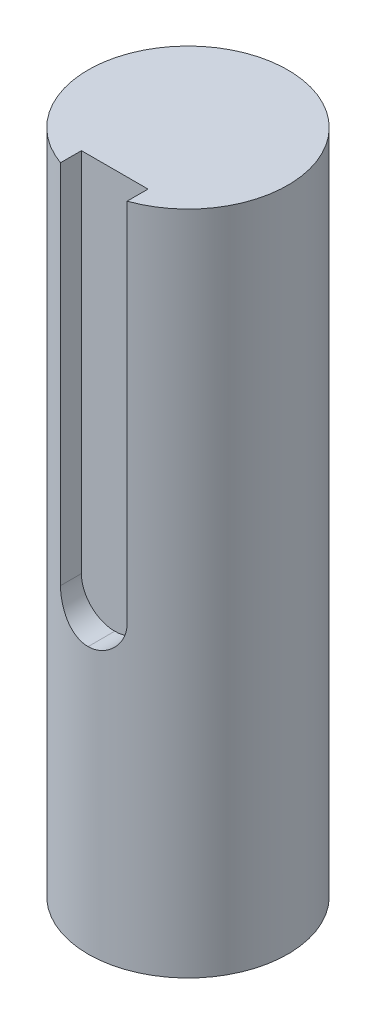
from build123d import *

# Parameters (mm, degrees)
SKETCH2_R           = 15
BOSS_EXTRUDE1_DEPTH = 50
SKETCH3_W           = 10
SKETCH3_H           = 8
CUT_EXTRUDE1_DEPTH  = 60
FILLET1_R           = 5


with BuildPart() as part:
    # Sketch2 → Boss-Extrude1 (new, symmetric)
    with BuildSketch(Plane(origin=(0, 0, 0), x_dir=(-1, 0, 0), z_dir=(0, 1, 0))):
        with Locations(Location((0, 0, 0), (0, 0, 90))):
            Circle(SKETCH2_R)
    extrude(amount=BOSS_EXTRUDE1_DEPTH, both=True)

    # Sketch3 → Cut-Extrude1 (cut)
    with BuildSketch(Plane(origin=(0, 50, 0), x_dir=(-1, 0, 0), z_dir=(0, 1, 0))):
        with Locations((0, 15)):
            Rectangle(SKETCH3_W, SKETCH3_H)
    extrude(amount=-CUT_EXTRUDE1_DEPTH, mode=Mode.SUBTRACT)

    # Fillet1
    fillet1_edges = [part.edges().sort_by_distance(p)[0] for p in [
        (5, -10, 12.571067812),
        (-5, -10, 12.571067812),
    ]]
    fillet(fillet1_edges, radius=FILLET1_R - 0.0001)  # a hair under: the kernel refuses the full size


solid = part.part
